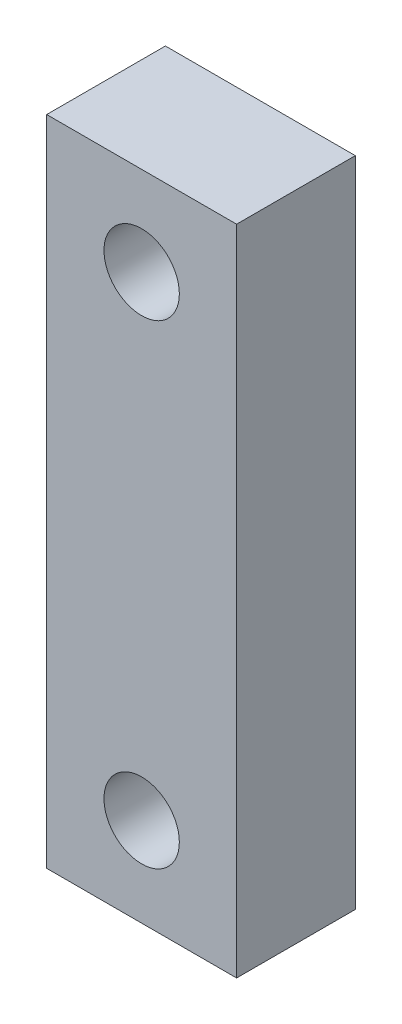
from build123d import *

# Parameters (mm, degrees)
SKETCH1_W           = 16
SKETCH1_H           = 55
SKETCH1_R           = 3.175
BOSS_EXTRUDE1_DEPTH = 10


with BuildPart() as part:
    # Sketch1 → Boss-Extrude1 (new body)
    with BuildSketch(Plane.XY):
        with Locations((0, 20)):
            Rectangle(SKETCH1_W, SKETCH1_H)
        with Locations((0, 40)):
            Circle(SKETCH1_R, mode=Mode.SUBTRACT)
        Circle(SKETCH1_R, mode=Mode.SUBTRACT)
    extrude(amount=BOSS_EXTRUDE1_DEPTH)


solid = part.part
